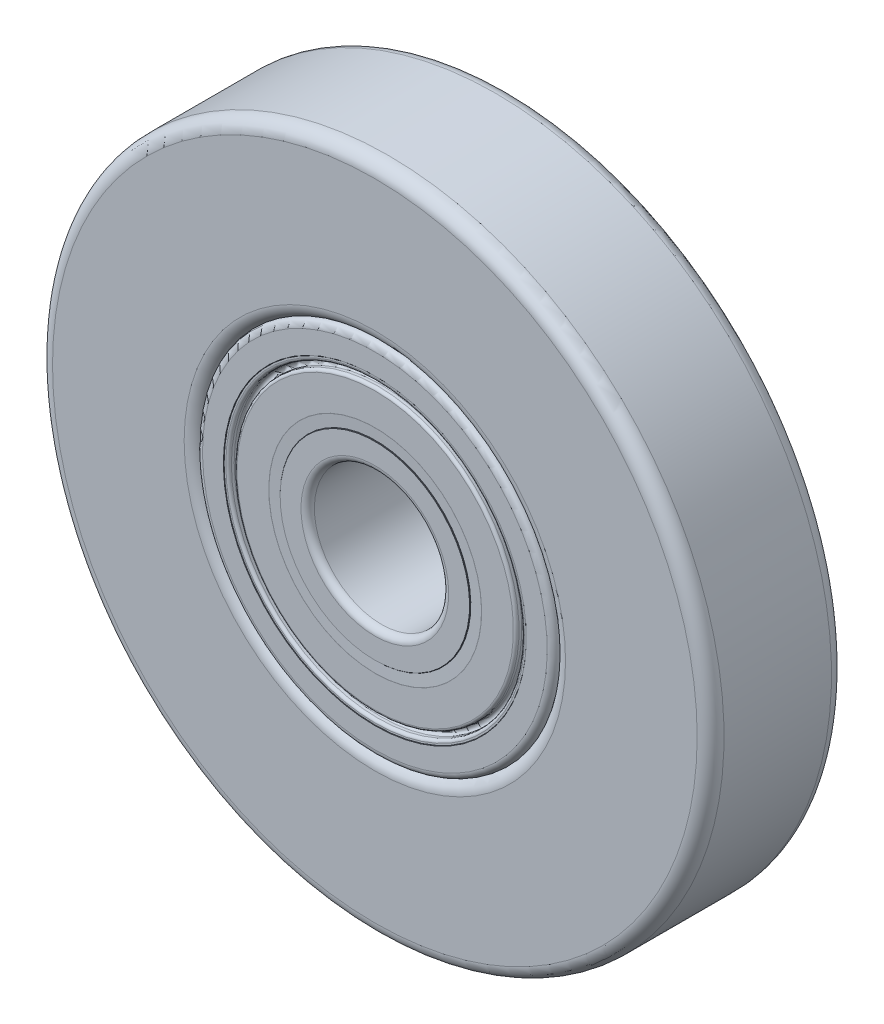
from build123d import *

# Parameters (mm, degrees)
EXTRUDE_START   = -1.5
SKETCH_1_R      = 7.5
SKETCH_1_R_2    = 4
EXTRUDE_2_DEPTH = 3
FILLET_1_R      = 0.3


with BuildPart() as part:
    # Sketch R, INNER BODY → Revolve INNER BODY (revolve)
    with BuildSketch(Plane(origin=(0, 0, 0), x_dir=(0, 0, -1), z_dir=(1, 0, 0)), mode=Mode.PRIVATE) as revolve_inner_body_sk:
        with BuildLine():
            Line((-1.492, 2.125), (-1.5, 2.117))
            Line((-1.5, 2.117), (-1.5, 1.65))
            ThreePointArc((-1.5, 1.65), (-1.456066017, 1.543933983), (-1.35, 1.5))
            Line((-1.35, 1.5), (1.35, 1.5))
            ThreePointArc((1.35, 1.5), (1.456066017, 1.543933983), (1.5, 1.65))
            Line((1.5, 1.65), (1.5, 2.117))
            Line((1.5, 2.117), (1.492, 2.125))
            Line((1.492, 2.125), (-1.492, 2.125))
        make_face()
    revolve(revolve_inner_body_sk.sketch.rotate(Axis((0, 0, 8.89), (0, 0, -1)), 180), axis=Axis((0, 0, 8.89), (0, 0, -1)))



with BuildPart() as body_2:
    # Sketch R, OUTER BODY → Revolve OUTER BODY (revolve)
    with BuildSketch(Plane(origin=(0, 0, 0), x_dir=(0, 0, -1), z_dir=(1, 0, 0)), mode=Mode.PRIVATE) as revolve_outer_body_sk:
        with BuildLine():
            Line((-1.5, 3.85), (-1.5, 3.383))
            Line((-1.5, 3.383), (-1.492, 3.375))
            Line((-1.492, 3.375), (1.492, 3.375))
            Line((1.492, 3.375), (1.5, 3.383))
            Line((1.5, 3.383), (1.5, 3.85))
            ThreePointArc((1.5, 3.85), (1.456066017, 3.956066017), (1.35, 4))
            Line((1.35, 4), (-1.35, 4))
            ThreePointArc((-1.35, 4), (-1.456066017, 3.956066017), (-1.5, 3.85))
        make_face()
    revolve(revolve_outer_body_sk.sketch.rotate(Axis((0, 0, 8.89), (0, 0, -1)), 180), axis=Axis((0, 0, 8.89), (0, 0, -1)))


with BuildPart() as body_3:
    # Sketch R, SHIELD FACES → Revolve SHIELDS (revolve)
    with BuildSketch(Plane(origin=(0, 0, 0), x_dir=(0, 0, -1), z_dir=(1, 0, 0)), mode=Mode.PRIVATE) as revolve_shields_sk:
        with BuildLine():
            Line((-1.492, 3.375), (-1.492, 3.3375))
            ThreePointArc((-1.492, 3.3375), (-1.473694174, 3.293305826), (-1.4295, 3.275))
            Line((-1.4295, 3.275), (-1.367, 3.275))
            ThreePointArc((-1.367, 3.275), (-1.3045, 3.2125), (-1.367, 3.15))
            Line((-1.367, 3.15), (-1.4295, 3.15))
            ThreePointArc((-1.4295, 3.15), (-1.473694174, 3.131694174), (-1.492, 3.0875))
            Line((-1.492, 3.0875), (-1.492, 2.377726212))
            ThreePointArc((-1.492, 2.377726212), (-1.491985127, 2.376362781), (-1.491940514, 2.375))
            Line((-1.491940514, 2.375), (-1.481025278, 2.125))
            Line((-1.481025278, 2.125), (1.481025278, 2.125))
            Line((1.481025278, 2.125), (1.491940514, 2.375))
            ThreePointArc((1.491940514, 2.375), (1.491985127, 2.376362781), (1.492, 2.377726212))
            Line((1.492, 2.377726212), (1.492, 3.0875))
            ThreePointArc((1.492, 3.0875), (1.473694174, 3.131694174), (1.4295, 3.15))
            Line((1.4295, 3.15), (1.367, 3.15))
            ThreePointArc((1.367, 3.15), (1.3045, 3.2125), (1.367, 3.275))
            Line((1.367, 3.275), (1.4295, 3.275))
            ThreePointArc((1.4295, 3.275), (1.473694174, 3.293305826), (1.492, 3.3375))
            Line((1.492, 3.3375), (1.492, 3.375))
            Line((1.492, 3.375), (-1.492, 3.375))
        make_face()
    revolve(revolve_shields_sk.sketch.rotate(Axis((0, 0, 8.89), (0, 0, -1)), 180), axis=Axis((0, 0, 8.89), (0, 0, -1)))


with BuildPart() as part_1:
    add(part.part)

    add(body_3.part)  # 凸台-拉伸2 merges body 3

    add(body_2.part)  # 凸台-拉伸2 merges body 2
    # 草图1 → 凸台-拉伸2 (add)
    with BuildSketch(Plane.XY.offset(EXTRUDE_START)):
        with Locations(Location((0, 0, 0), (0, 0, 270))):
            Circle(SKETCH_1_R)
        with Locations(Location((0, 0, 0), (0, 0, 270))):
            Circle(SKETCH_1_R_2, mode=Mode.SUBTRACT)
    extrude(amount=EXTRUDE_2_DEPTH)

    # 圆角1
    # the kernel refuses this fillet: 0.3 mm, written as the material it takes off along each edge
    with BuildSketch(Plane(origin=(0, 0, 1.5), x_dir=(0, -1, 0), z_dir=(-1, 0, 0))) as fillet_1_piece_1:
        with BuildLine():
            CenterArc((4.259807621, -0.3), FILLET_1_R, 90, 60)
            Line((4.259807621, 0), (4, 0))
            Line((4, 0), (4, -0.15))
        make_face()
    revolve(axis=Axis((0, 0, 1.5), (0, 0, 1)), mode=Mode.SUBTRACT)
    with BuildSketch(Plane(origin=(0, 0, 1.5), x_dir=(0, -1, 0), z_dir=(-1, 0, 0))) as fillet_1_piece_2:
        with BuildLine():
            CenterArc((7.5 - FILLET_1_R, -FILLET_1_R), FILLET_1_R, 0, 90)
            Line((7.5, -FILLET_1_R), (7.5, 0))
            Line((7.5, 0), (7.5 - FILLET_1_R, 0))
        make_face()
    revolve(axis=Axis((0, 0, 1.5), (0, 0, 1)), mode=Mode.SUBTRACT)
    with BuildSketch(Plane(origin=(0, 0, -1.5), x_dir=(0, -1, 0), z_dir=(-1, 0, 0))) as fillet_1_piece_3:
        with BuildLine():
            CenterArc((7.5 - FILLET_1_R, FILLET_1_R), FILLET_1_R, 270, 90)
            Line((7.5 - FILLET_1_R, 0), (7.5, 0))
            Line((7.5, 0), (7.5, FILLET_1_R))
        make_face()
    revolve(axis=Axis((0, 0, -1.5), (0, 0, 1)), mode=Mode.SUBTRACT)


solid = part_1.part
